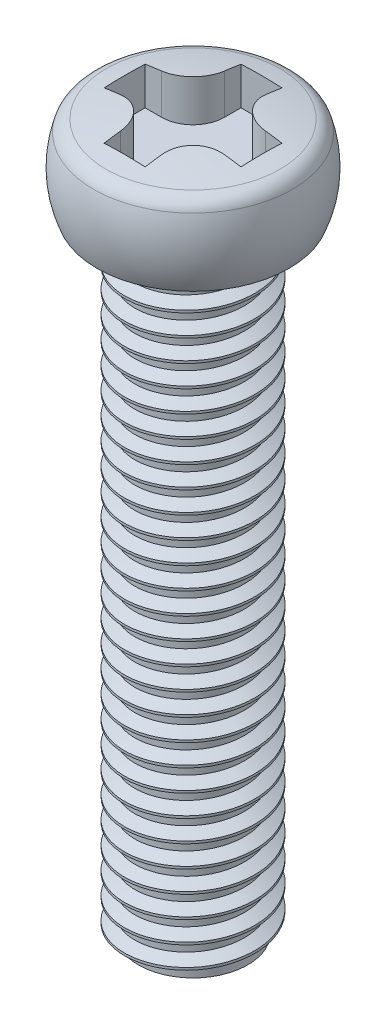
from build123d import *

# Parameters (mm, degrees)
SKETCH1_W           = 1.756238879
SKETCH1_H           = 1.45
SKETCH2_W           = 0.75
SKETCH2_H           = 0.75
CUT_EXTRUDE1_DEPTH  = 0.8
SKETCH3_R           = 1
BOSS_EXTRUDE1_DEPTH = 11.4
THREAD1_PITCH       = 0.4
FILLET1_R           = 0.3


with BuildPart() as part:
    # Sketch1 → Revolve1 (revolve)
    with BuildSketch(Plane.XY):
        with BuildLine():
            Line((0, 1.45), (1.756238879, 1.45))
            ThreePointArc((1.756238879, 1.45), (0.883795084, 1.599838935), (0, 1.65))
            Line((0, 1.65), (0, 1.45))
        make_face()
        with Locations((0.87811944, 0.725)):
            Rectangle(SKETCH1_W, SKETCH1_H)
        with BuildLine():
            ThreePointArc((1.756238879, 1.45), (1.9, 0.725), (1.756238879, 0))
            Line((1.756238879, 0), (1.756238879, 1.45))
        make_face()
    revolve(axis=Axis((0, 1.65, 0), (0, -1, 0)))

    # Sketch2 → Cut-Extrude1 (cut)
    with BuildSketch(Plane(origin=(0, 1.65, 0), x_dir=(1, 0, 0), z_dir=(0, 1, 0))):
        Polygon((-0.375, 0.375), (0.375, 0.375), (0.375, 0.95), (0.375, 1.25), (-0.375, 1.25), (-0.375, 0.95), align=None)
        with BuildLine():
            Line((-0.95, 0.375), (-0.375, 0.375))
            Line((-0.375, 0.375), (-0.375, 0.95))
            ThreePointArc((-0.375, 0.95), (-0.543413601, 0.543413601), (-0.95, 0.375))
        make_face()
        Polygon((-0.95, -0.375), (-0.375, -0.375), (-0.375, 0.375), (-0.95, 0.375), (-1.25, 0.375), (-1.25, -0.375), align=None)
        Rectangle(SKETCH2_W, SKETCH2_H)
        Polygon((-0.375, -1.25), (0.375, -1.25), (0.375, -0.95), (0.375, -0.375), (-0.375, -0.375), (-0.375, -0.95), align=None)
        Polygon((0.375, 0.375), (0.375, -0.375), (0.95, -0.375), (1.25, -0.375), (1.25, 0.375), (0.95, 0.375), align=None)
        with BuildLine():
            Line((0.375, 0.95), (0.375, 0.375))
            Line((0.375, 0.375), (0.95, 0.375))
            ThreePointArc((0.95, 0.375), (0.543413601, 0.543413601), (0.375, 0.95))
        make_face()
        with BuildLine():
            Line((0.375, -0.375), (0.375, -0.95))
            ThreePointArc((0.375, -0.95), (0.543413601, -0.543413601), (0.95, -0.375))
            Line((0.95, -0.375), (0.375, -0.375))
        make_face()
        with BuildLine():
            ThreePointArc((-0.95, -0.375), (-0.543413601, -0.543413601), (-0.375, -0.95))
            Line((-0.375, -0.95), (-0.375, -0.375))
            Line((-0.375, -0.375), (-0.95, -0.375))
        make_face()
    extrude(amount=-CUT_EXTRUDE1_DEPTH, mode=Mode.SUBTRACT)

    # Sketch3 → Boss-Extrude1 (add)
    with BuildSketch(Plane.XZ):
        Circle(SKETCH3_R)
    extrude(amount=BOSS_EXTRUDE1_DEPTH)

    # Thread1: arcs per turn and ends read off the stored shape
    # Thread1: the profile of Thread Profile1 profile screwed along a right-hand helix through 28.5 turns, 6 arcs to a turn; built about Z, then put on its axis
    thread1_z = Axis((0, 0, 0), (0, 0, 1))
    thread1_corners = [(-0.9997, 0, -11.400173205), (-1.189443056, 0, -11.290625), (-1.189443056, 0, -11.246875), (-0.9997, 0, -11.137326796)]
    with BuildLine(mode=Mode.PRIVATE) as thread1_profile:
        Line(thread1_corners[0], thread1_corners[1])
        Line(thread1_corners[1], thread1_corners[2])
        Line(thread1_corners[2], thread1_corners[3])
        Line(thread1_corners[3], thread1_corners[0])
    thread1_cap = Face(thread1_profile.wire())
    thread1_turn_angles = [0, 30, 60, 90, 120, 150, 180, 210, 240, 270, 300, 330, 360]
    thread1_turn_weights = [1, 0.8660254037844387, 1, 0.8660254037844387, 1, 0.8660254037844387, 1, 0.8660254037844387, 1, 0.8660254037844387, 1, 0.8660254037844387, 1]
    thread1_turn_rails = [Edge.make_bspline([Vector(p[0], p[1], 0).rotate(thread1_z, thread1_turn_angles[k]) / thread1_turn_weights[k] + Vector(0, 0, p[2] + THREAD1_PITCH * thread1_turn_angles[k] / 360) for k in range(13)], [0, 0, 0, 1, 1, 2, 2, 3, 3, 4, 4, 5, 5, 6, 6, 6], 2, thread1_turn_weights) for p in thread1_corners]
    thread1_turn_sides = [Face.make_surface_from_curves(thread1_turn_rails[p[0]], thread1_turn_rails[p[1]]) for p in [(0, 1), (1, 2), (2, 3), (3, 0)]]
    thread1_last_angles = [10080, 10110, 10140, 10170, 10200, 10230, 10260]
    thread1_last_weights = [1, 0.8660254037844387, 1, 0.8660254037844387, 1, 0.8660254037844387, 1]
    thread1_last_rails = [Edge.make_bspline([Vector(p[0], p[1], 0).rotate(thread1_z, thread1_last_angles[k]) / thread1_last_weights[k] + Vector(0, 0, p[2] + THREAD1_PITCH * thread1_last_angles[k] / 360) for k in range(7)], [0, 0, 0, 1, 1, 2, 2, 3, 3, 3], 2, thread1_last_weights) for p in thread1_corners]
    thread1_last_sides = [Face.make_surface_from_curves(thread1_last_rails[p[0]], thread1_last_rails[p[1]]) for p in [(0, 1), (1, 2), (2, 3), (3, 0)]]
    thread1 = Plane(origin=(0, 0, 0), x_dir=(1, 0, 0), z_dir=(0, 1, 0)) * Solid(Shell([*[p.moved(Location((0, 0, THREAD1_PITCH * i))) for i in range(28) for p in thread1_turn_sides], *thread1_last_sides, thread1_cap, thread1_cap.rotate(thread1_z, 10260).moved(Location((0, 0, THREAD1_PITCH * 10260 / 360)))]))
    add(thread1)

    # Fillet1
    fillet1_edges = [part.edges().sort_by_distance(p)[0] for p in [
        (-1.756238879, 1.45, 0),
    ]]
    fillet(fillet1_edges, radius=FILLET1_R)


solid = part.part
